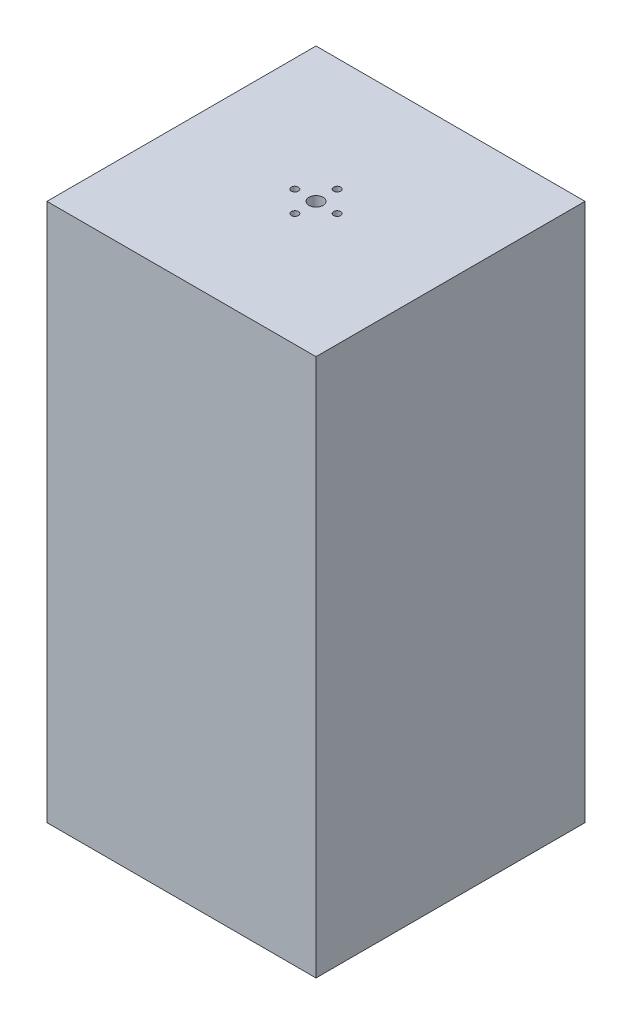
from build123d import *

# Parameters (mm, degrees)
SKETCH1_W           = 76.2
SKETCH1_H           = 152.4
BOSS_EXTRUDE1_DEPTH = 76.2
SKETCH2_W           = 68.58
SKETCH2_H           = 68.58
CUT_EXTRUDE1_DEPTH  = 148.59
SKETCH3_R           = 2
SKETCH3_R_2         = 1
CUT_EXTRUDE2_DEPTH  = 187.6511184


with BuildPart() as part:
    # Sketch1 → Boss-Extrude1 (new body)
    with BuildSketch(Plane.XY):
        with Locations((38.1, 76.2)):
            Rectangle(SKETCH1_W, SKETCH1_H)
    extrude(amount=-BOSS_EXTRUDE1_DEPTH)

    # Sketch2 → Cut-Extrude1 (cut)
    with BuildSketch(Plane.XZ):
        with Locations((38.1, -38.1)):
            Rectangle(SKETCH2_W, SKETCH2_H)
    extrude(amount=-CUT_EXTRUDE1_DEPTH, mode=Mode.SUBTRACT)

    # Sketch3 → Cut-Extrude2 (cut, through all)
    with BuildSketch(Plane(origin=(0, 152.4, 0), x_dir=(1, 0, 0), z_dir=(0, 1, 0))):
        with Locations((38.1, 38.1)):
            Circle(SKETCH3_R)
        with Locations((38.1, 44.1)):
            Circle(SKETCH3_R_2)
        with Locations((38.1, 32.1)):
            Circle(SKETCH3_R_2)
        with Locations((44.1, 38.1)):
            Circle(SKETCH3_R_2)
        with Locations((32.1, 38.1)):
            Circle(SKETCH3_R_2)
    extrude(amount=-CUT_EXTRUDE2_DEPTH, mode=Mode.SUBTRACT)


solid = part.part
